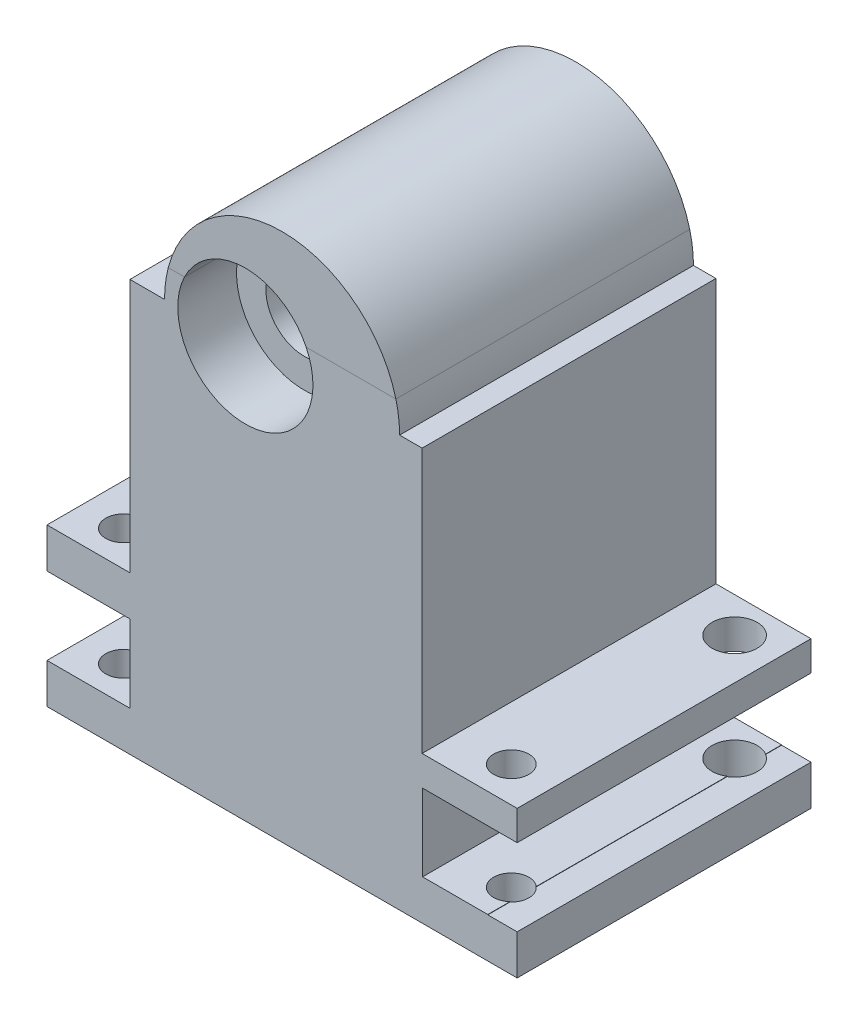
from build123d import *

# Parameters (mm, degrees)
BOSS_EXTRU_1_DEPTH      = 500
ESQUISSE2_W             = 700
ESQUISSE2_H             = 500
BOSS_EXTRU_2_DEPTH      = 250
ESQUISSE3_R             = 65
ENL_V_MAT_EXTRU_1_DEPTH = 500
ESQUISSE4_W             = 91.072749712
ESQUISSE4_H             = 131.669737078
ENL_V_MAT_EXTRU_2_DEPTH = 500
ESQUISSE5_W             = 110.887682399
ESQUISSE5_H             = 130.745719327
ENL_V_MAT_EXTRU_3_DEPTH = 500
ENL_V_START             = -100
ESQUISSE6_R             = 115
ESQUISSE6_R_2           = 65
ENL_V_MAT_EXTRU_4_DEPTH = 100
ESQUISSE7_R             = 115
ESQUISSE7_R_2           = 65
ENL_V_MAT_EXTRU_5_DEPTH = 100
ESQUISSE9_W             = 50
ESQUISSE9_H             = 500.658692186
ESQUISSE9_H_2           = 68.053564491
ESQUISSE9_H_3           = 500.318853577
ESQUISSE9_H_4           = 68.011409345
BOSS_EXTRU_3_DEPTH      = 500
ESQUISSE10_W            = 141.072749712
ESQUISSE10_H            = 432.308853577
ESQUISSE10_W_2          = 161.717775925
ESQUISSE10_H_2          = 450
ENL_V_MAT_EXTRU_6_DEPTH = 500
ESQUISSE11_R            = 30
ENL_V_MAT_EXTRU_7_DEPTH = 310
ESQUISSE12_R            = 38.334173136
ESQUISSE12_R_2          = 30
ENL_V_MAT_EXTRU_8_DEPTH = 310


with BuildPart() as part:
    # Esquisse1 → Boss.-Extru.1 (new body)
    with BuildSketch(Plane.XY):
        with BuildLine():
            Line((0, 0), (700, 0))
            Line((700, 0), (700, 450))
            Line((700, 450), (550, 450))
            ThreePointArc((550, 450), (350, 650), (150, 450))
            Line((150, 450), (0, 450))
            Line((0, 450), (0, 0))
        make_face()
    extrude(amount=BOSS_EXTRU_1_DEPTH)

    # Esquisse2 → Boss.-Extru.2 (add)
    with BuildSketch(Plane.XZ):
        with Locations((350, 250)):
            Rectangle(ESQUISSE2_W, ESQUISSE2_H)
    extrude(amount=BOSS_EXTRU_2_DEPTH)

    # Esquisse3 → Enlèv. mat.-Extru.1 (cut)
    with BuildSketch(Plane(origin=(0, 0, 0), x_dir=(-1, 0, 0), z_dir=(0, 0, -1))):
        with Locations((-287.5, 450)):
            Circle(ESQUISSE3_R)
    extrude(amount=-ENL_V_MAT_EXTRU_1_DEPTH, mode=Mode.SUBTRACT)

    # Esquisse4 → Enlèv. mat.-Extru.2 (cut)
    with BuildSketch(Plane(origin=(0, 0, 0), x_dir=(-1, 0, 0), z_dir=(0, 0, -1))):
        with Locations((-45.536374856, -116.153722116)):
            Rectangle(ESQUISSE4_W, ESQUISSE4_H)
    extrude(amount=-ENL_V_MAT_EXTRU_2_DEPTH, mode=Mode.SUBTRACT)

    # Esquisse5 → Enlèv. mat.-Extru.3 (cut)
    with BuildSketch(Plane(origin=(0, 0, 0), x_dir=(-1, 0, 0), z_dir=(0, 0, -1))):
        with Locations((-644.556158801, -116.03155185)):
            Rectangle(ESQUISSE5_W, ESQUISSE5_H)
    extrude(amount=-ENL_V_MAT_EXTRU_3_DEPTH, mode=Mode.SUBTRACT)

    # Esquisse6 → Enlèv. mat.-Extru.4 (cut)
    with BuildSketch(Plane.XY.offset(500).offset(ENL_V_START)):
        with Locations((287.5, 450)):
            Circle(ESQUISSE6_R)
        with Locations((287.5, 450)):
            Circle(ESQUISSE6_R_2, mode=Mode.SUBTRACT)
    extrude(amount=ENL_V_MAT_EXTRU_4_DEPTH, mode=Mode.SUBTRACT)


with BuildPart() as body_2:
    # Fractionner2: the piece on the far side of the plane
    add(part.part)
    split(bisect_by=Plane(origin=(0, 500, 0), x_dir=(0, 0, -1), z_dir=(0, -1, 0)), keep=Keep.BOTTOM)


with BuildPart() as part_1:
    add(part.part)

    # Fractionner2
    split(bisect_by=Plane(origin=(0, 500, 0), x_dir=(0, 0, -1), z_dir=(0, -1, 0)), keep=Keep.TOP)


with BuildPart() as enl_v_mat_extru_5_tool:
    # Esquisse7 → Enlèv. mat.-Extru.5 (new body)
    with BuildSketch(Plane(origin=(0, 0, 0), x_dir=(-1, 0, 0), z_dir=(0, 0, -1))):
        with Locations((-287.5, 450)):
            Circle(ESQUISSE7_R)
        with Locations((-287.5, 450)):
            Circle(ESQUISSE7_R_2, mode=Mode.SUBTRACT)
    extrude(amount=-ENL_V_MAT_EXTRU_5_DEPTH)


with BuildPart() as part_2:
    add(part_1.part)

    # Enlèv. mat.-Extru.5: cut by enl_v_mat_extru_5_tool
    add(enl_v_mat_extru_5_tool.part, mode=Mode.SUBTRACT)

    # Esquisse9 → Boss.-Extru.3 (add)
    with BuildSketch(Plane.XY.offset(500)):
        with Locations((725, 199.670653907)):
            Rectangle(ESQUISSE9_W, ESQUISSE9_H)
        with Locations((725, -215.973217755)):
            Rectangle(ESQUISSE9_W, ESQUISSE9_H_2)
        with Locations((-25, 199.840573211)):
            Rectangle(ESQUISSE9_W, ESQUISSE9_H_3)
        with Locations((-25, -215.994295328)):
            Rectangle(ESQUISSE9_W, ESQUISSE9_H_4)
    extrude(amount=-BOSS_EXTRU_3_DEPTH)

    # Esquisse10 → Enlèv. mat.-Extru.6 (cut)
    with BuildSketch(Plane.XY.offset(500)):
        with Locations((20.536374856, 233.845573212)):
            Rectangle(ESQUISSE10_W, ESQUISSE10_H)
        with Locations((669.141112038, 225)):
            Rectangle(ESQUISSE10_W_2, ESQUISSE10_H_2)
    extrude(amount=-ENL_V_MAT_EXTRU_6_DEPTH, mode=Mode.SUBTRACT)

    # Esquisse11 → Enlèv. mat.-Extru.7 (cut)
    with BuildSketch(Plane(origin=(0, 17.691146423, 0), x_dir=(1, 0, 0), z_dir=(0, 1, 0))):
        with Locations((20, -60)):
            Circle(ESQUISSE11_R)
        with Locations((20, -440)):
            Circle(ESQUISSE11_R)
    extrude(amount=-ENL_V_MAT_EXTRU_7_DEPTH, mode=Mode.SUBTRACT)

    # Esquisse12 → Enlèv. mat.-Extru.8 (cut)
    with BuildSketch(Plane(origin=(0, 0, 0), x_dir=(1, 0, 0), z_dir=(0, 1, 0))):
        with Locations((680, -60)):
            Circle(ESQUISSE12_R)
        with Locations((680, -440)):
            Circle(ESQUISSE12_R_2)
    extrude(amount=-ENL_V_MAT_EXTRU_8_DEPTH, mode=Mode.SUBTRACT)


with BuildPart() as body_2_1:
    add(body_2.part)

    # Enlèv. mat.-Extru.5: cut by enl_v_mat_extru_5_tool
    add(enl_v_mat_extru_5_tool.part, mode=Mode.SUBTRACT)


solid = Compound([part_2.part, body_2_1.part])
